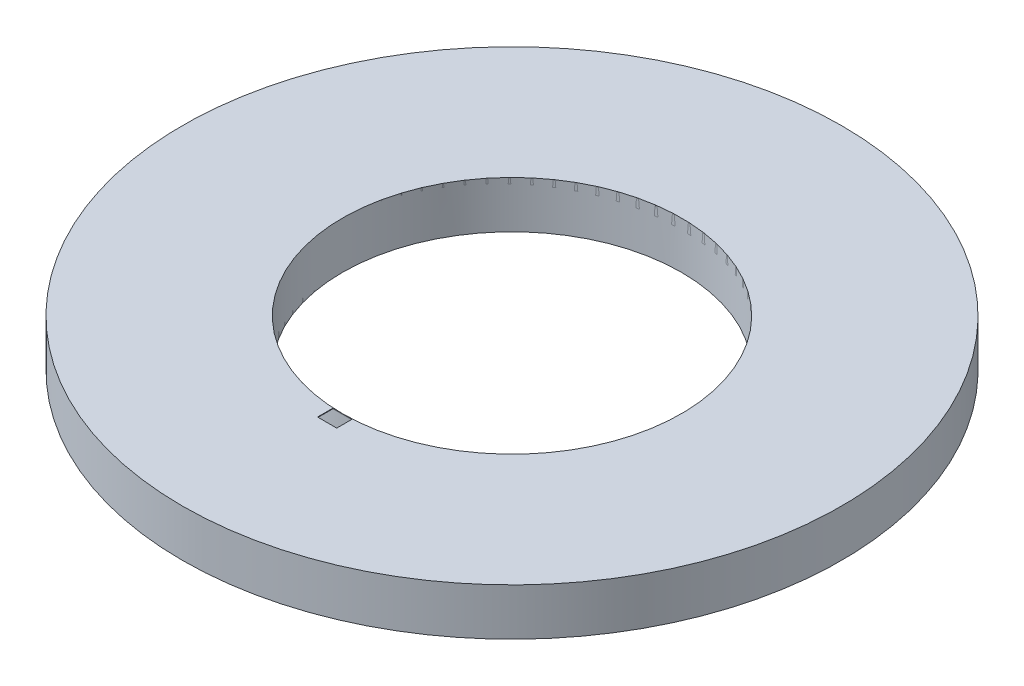
from build123d import *

# Parameters (mm, degrees)
SKETCH1_R               = 1750
BOSS_EXTRUDE1_DEPTH     = 500
SKETCH2_R               = 900
CUT_EXTRUDE2_DEPTH      = 300
SKETCH3_R               = 600
CUT_EXTRUDE3_DEPTH      = 300
SKETCH4_R               = 1748.5
SKETCH4_R_2             = 900.75
CUT_EXTRUDE5_DEPTH      = 497
CUT_EXTRUDE6_DEPTH      = 2525.876234591
CUT_EXTRUDE6_DEPTH_BACK = 2525.876234591
SKETCH5_W               = 3500
SKETCH5_H               = 250
CUT_EXTRUDE7_DEPTH      = 10


with BuildPart() as part:
    # Sketch1 → Boss-Extrude1 (new body)
    with BuildSketch(Plane(origin=(0, 0, 0), x_dir=(1, 0, 0), z_dir=(0, 1, 0))):
        Circle(SKETCH1_R)
    extrude(amount=BOSS_EXTRUDE1_DEPTH)

    # Sketch2 → Cut-Extrude2 (cut)
    with BuildSketch(Plane(origin=(0, 500, 0), x_dir=(1, 0, 0), z_dir=(0, 1, 0))):
        Circle(SKETCH2_R)
    extrude(amount=-CUT_EXTRUDE2_DEPTH, mode=Mode.SUBTRACT)

    # Sketch3 → Cut-Extrude3 (cut)
    with BuildSketch(Plane.XZ):
        Circle(SKETCH3_R)
    extrude(amount=-CUT_EXTRUDE3_DEPTH, mode=Mode.SUBTRACT)

    # Sketch4 → Cut-Extrude5 (cut)
    with BuildSketch(Plane(origin=(0, 0, 0), x_dir=(-1, 0, 0), z_dir=(0, -1, 0))):
        Circle(SKETCH4_R)
        Circle(SKETCH4_R_2, mode=Mode.SUBTRACT)
    extrude(amount=-CUT_EXTRUDE5_DEPTH, mode=Mode.SUBTRACT)

    # Sketch5 → Cut-Extrude6 (cut, two sides: drawn at the far end of the back side and taken through both)
    with BuildSketch(Plane.XY.offset(-CUT_EXTRUDE6_DEPTH_BACK)):
        with Locations((0, 125)):
            Rectangle(SKETCH5_W, SKETCH5_H)
    extrude(amount=CUT_EXTRUDE6_DEPTH + CUT_EXTRUDE6_DEPTH_BACK, mode=Mode.SUBTRACT)

    # Sketch6 → Cut-Extrude7 (cut)
    with BuildSketch(Plane.XZ.offset(-497)):
        Polygon((0, 900.75), (51, 900.75), (51, 981.75), (-51, 981.75), (-51, 900.75), align=None)
    extrude(amount=-CUT_EXTRUDE7_DEPTH, mode=Mode.SUBTRACT)


solid = part.part
